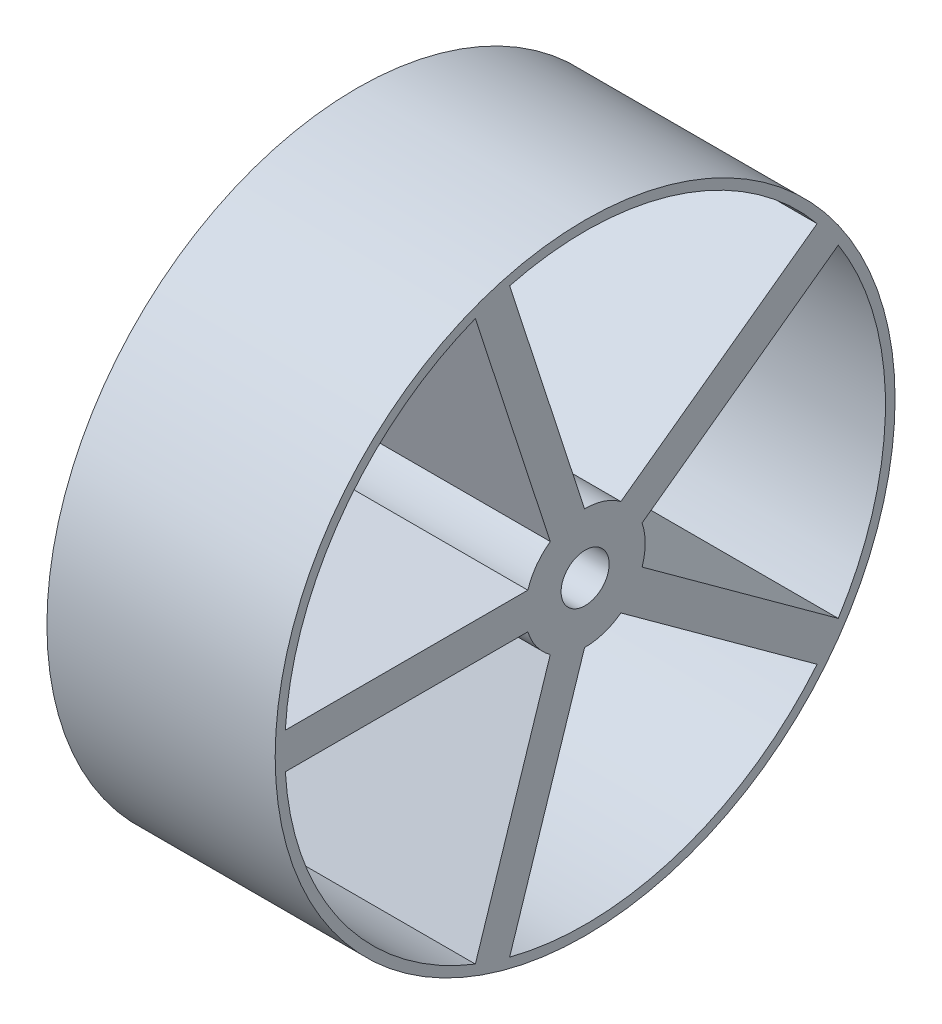
from build123d import *

# Parameters (mm, degrees)
SKETCH2_R           = 129
SKETCH2_R_2         = 10
BOSS_EXTRUDE1_DEPTH = 47.5


with BuildPart() as part:
    # Sketch2 → Boss-Extrude1 (new, symmetric)
    with BuildSketch(Plane.YZ):
        Circle(SKETCH2_R)
        with BuildLine():
            ThreePointArc((20.363624884, 14.502509493), (14.694631307, 20.225424859), (7.5, 23.848480035))
            Line((7.5, 23.848480035), (7.5, 124.774797135))
            ThreePointArc((7.5, 124.774797135), (73.473156537, 101.127124297), (116.350256427, 45.690456657))
            Line((116.350256427, 45.690456657), (20.363624884, 14.502509493))
        make_face(mode=Mode.SUBTRACT)
        with BuildLine():
            Line((24.998879799, 0.236661749), (120.985511342, 31.424608912))
            ThreePointArc((120.985511342, 31.424608912), (118.882064537, -38.627124297), (79.408413071, -96.536541959))
            Line((79.408413071, -96.536541959), (20.085412312, -14.885436246))
            ThreePointArc((20.085412312, -14.885436246), (23.776412907, -7.725424859), (24.998879799, 0.236661749))
        make_face(mode=Mode.SUBTRACT)
        with BuildLine():
            ThreePointArc((-7.950157397, -23.702215031), (0, -25), (7.950157397, -23.702215031))
            Line((7.950157397, -23.702215031), (67.273158156, -105.353320744))
            ThreePointArc((67.273158156, -105.353320744), (0, -125), (-67.273158156, -105.353320744))
            Line((-67.273158156, -105.353320744), (-7.950157397, -23.702215031))
        make_face(mode=Mode.SUBTRACT)
        with BuildLine():
            ThreePointArc((-24.998879799, 0.236661749), (-23.776412907, -7.725424859), (-20.085412312, -14.885436246))
            Line((-20.085412312, -14.885436246), (-79.408413071, -96.536541959))
            ThreePointArc((-79.408413071, -96.536541959), (-118.882064537, -38.627124297), (-120.985511342, 31.424608912))
            Line((-120.985511342, 31.424608912), (-24.998879799, 0.236661749))
        make_face(mode=Mode.SUBTRACT)
        with BuildLine():
            ThreePointArc((-7.5, 23.848480035), (-14.694631307, 20.225424859), (-20.363624884, 14.502509493))
            Line((-20.363624884, 14.502509493), (-116.350256427, 45.690456657))
            ThreePointArc((-116.350256427, 45.690456657), (-73.473156537, 101.127124297), (-7.5, 124.774797135))
            Line((-7.5, 124.774797135), (-7.5, 23.848480035))
        make_face(mode=Mode.SUBTRACT)
        Circle(SKETCH2_R_2, mode=Mode.SUBTRACT)
    boss_extrude1 = extrude(amount=BOSS_EXTRUDE1_DEPTH, both=True)

    # Mirror2: Boss-Extrude1 across plane
    add(boss_extrude1.mirror(Plane(origin=(0, 0, 0), x_dir=(0, 0, 1), z_dir=(1, 0, 0))))


solid = part.part
